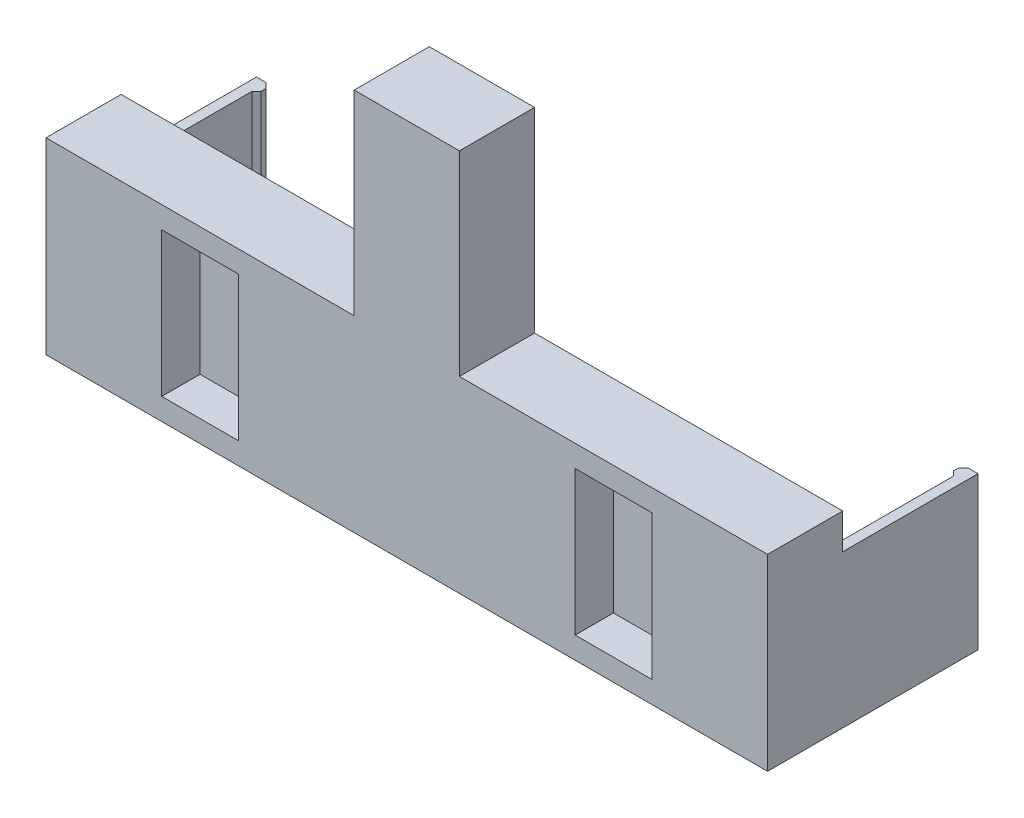
from build123d import *

# Parameters (mm, degrees)
SKETCH1_W                = 1.5
SKETCH1_H                = 25
SKETCH1_W_2              = 14
SKETCH1_H_2              = 26
SKETCH1_R                = 2
BOSS_EXTRUDE1_DEPTH      = 10
SKETCH1_3_W              = 1.5
SKETCH1_3_H              = 25
BOSS_EXTRUDE2_DEPTH      = 18
SKETCH1_4_R              = 2
BOSS_EXTRUDE3_DEPTH      = 5
BOSS_EXTRUDE4_DEPTH      = 25
CUT_EXTRUDE1_DEPTH       = 4.7
CUT_EXTRUDE2_DEPTH       = 7
SKETCH8_W                = 10
SKETCH8_H                = 19
CUT_EXTRUDE3_DEPTH       = 5
MOVE_START               = -12.5
MOVE_FACE1_DEPTH         = 20.3
MOVE_START_2             = -5
MOVE_FACE1_2_OUTLINE_R   = 2
MOVE_FACE1_2_OUTLINE_R_2 = 1.85
MOVE_FACE1_2_DEPTH       = 5
MOVE_FACE1_3_OUTLINE_R   = 1.85
MOVE_FACE1_3_DEPTH       = 0.15
MOVE_FACE2_BY            = 0.1
MOVE_FACE2_2_BY          = 0.1
MOVE_FACE2_3_BY          = 0.1
MOVE_FACE2_4_BY          = 0.1
MOVE_FACE2_5_BY          = 0.1
MOVE_FACE2_6_BY          = 0.1
MOVE_FACE2_7_BY          = 0.1
MOVE_FACE2_8_BY          = 0.1
MOVE_FACE2_9_BY          = 0.1
MOVE_FACE2_10_BY         = 0.1


# Read off the part's stored shape, not the designer's step: Move Face1
with BuildPart() as part:
    # Sketch1 → Boss-Extrude1 (new body)
    # profile 1 of 5: a face of its own
    with BuildSketch(Plane.XY):
        Polygon((-7, 12.5), (-46.5, 12.5), (-46.5, -12.5), (46.5, -12.5), (46.5, 12.5), (7, 12.5), align=None)
    # profile 2 of 5: a face of its own
    with BuildSketch(Plane.XY):
        with Locations((-47.25, 0)):
            Rectangle(SKETCH1_W, SKETCH1_H)
    # profile 3 of 5: a face of its own
    with BuildSketch(Plane.XY):
        with Locations((47.25, 0)):
            Rectangle(SKETCH1_W, SKETCH1_H)
    # profile 4 of 5: a face of its own
    with BuildSketch(Plane.XY):
        with Locations((0, 25.5)):
            Rectangle(SKETCH1_W_2, SKETCH1_H_2)
        with Locations((0, 31.5)):
            Circle(SKETCH1_R, mode=Mode.SUBTRACT)
    # profile 5 of 5: a face of its own
    with BuildSketch(Plane.XY):
        with Locations((0, 31.5)):
            Circle(SKETCH1_R)
    extrude(amount=BOSS_EXTRUDE1_DEPTH)

    # Sketch1<3> → Boss-Extrude2 (add)
    with BuildSketch(Plane.XY):
        with Locations((47.25, 0)):
            Rectangle(SKETCH1_3_W, SKETCH1_3_H)
        with Locations((-47.25, 0)):
            Rectangle(SKETCH1_3_W, SKETCH1_3_H)
    extrude(amount=-BOSS_EXTRUDE2_DEPTH)

    # Sketch1<4> → Boss-Extrude3 (add)
    with BuildSketch(Plane.XY):
        with Locations((0, 31.5)):
            Circle(SKETCH1_4_R)
    extrude(amount=-BOSS_EXTRUDE3_DEPTH)

    # Sketch5 → Boss-Extrude4 (add)
    with BuildSketch(Plane(origin=(0, 12.5, 0), x_dir=(1, 0, 0), z_dir=(0, 1, 0))):
        Polygon((45.9, 17.4), (45.9, 16.6), (46.5, 16), (46.5, 18), align=None)
        Polygon((-45.9, 17.4), (-46.5, 18), (-46.5, 16), (-45.9, 16.6), align=None)
    extrude(amount=-BOSS_EXTRUDE4_DEPTH)

    # Sketch7 → Cut-Extrude1 (cut)
    with BuildSketch(Plane(origin=(0, 12.5, 0), x_dir=(1, 0, 0), z_dir=(0, 1, 0))):
        Polygon((46.5, 16), (46.5, 0), (48, 0), (48, 18), (46.5, 18), (45.9, 17.4), (45.9, 16.6), align=None)
    extrude(amount=-CUT_EXTRUDE1_DEPTH, mode=Mode.SUBTRACT)

    # Sketch7<4> → Cut-Extrude2 (cut)
    with BuildSketch(Plane(origin=(0, 12.5, 0), x_dir=(1, 0, 0), z_dir=(0, 1, 0))):
        Polygon((-48, 0), (-46.5, 0), (-46.5, 16), (-45.9, 16.6), (-45.9, 17.4), (-46.5, 18), (-48, 18), align=None)
    extrude(amount=-CUT_EXTRUDE2_DEPTH, mode=Mode.SUBTRACT)

    # Sketch8 → Cut-Extrude3 (cut)
    with BuildSketch(Plane.XY.offset(10)):
        with Locations((-27.5, 0)):
            Rectangle(SKETCH8_W, SKETCH8_H)
        with Locations((27.5, 0)):
            Rectangle(SKETCH8_W, SKETCH8_H)
    extrude(amount=-CUT_EXTRUDE3_DEPTH, mode=Mode.SUBTRACT)

    # Move Face1 outline → Move Face1 (cut)
    with BuildSketch(Plane(origin=(0, 0, 0), x_dir=(1, 0, 0), z_dir=(0, 1, 0)).offset(MOVE_START)):
        Polygon((-46.05, 16.662132034), (-46.65, 16.062132034), (-46.65, 0), (-46.5, 0), (-46.5, 16), (-45.9, 16.6), (-45.9, 17.4), (-46.5, 18), (-46.712132034, 18), (-46.05, 17.337867966), align=None)
        Polygon((46.5, 16), (46.5, 0), (46.65, 0), (46.65, 16.062132034), (46.05, 16.662132034), (46.05, 17.337867966), (46.712132034, 18), (46.5, 18), (45.9, 17.4), (45.9, 16.6), align=None)
    extrude(amount=MOVE_FACE1_DEPTH, mode=Mode.SUBTRACT)

    # Move Face1 2 outline → Move Face1 2 (cut)
    with BuildSketch(Plane.XY.offset(MOVE_START_2)):
        with Locations((0, 31.5)):
            Circle(MOVE_FACE1_2_OUTLINE_R)
        with Locations((0, 31.5)):
            Circle(MOVE_FACE1_2_OUTLINE_R_2, mode=Mode.SUBTRACT)
    extrude(amount=MOVE_FACE1_2_DEPTH, mode=Mode.SUBTRACT)

    # Move Face1 3 outline → Move Face1 3 (cut)
    with BuildSketch(Plane.XY.offset(MOVE_START_2)):
        with Locations((0, 31.5)):
            Circle(MOVE_FACE1_3_OUTLINE_R)
    extrude(amount=MOVE_FACE1_3_DEPTH, mode=Mode.SUBTRACT)

    # Move Face2: a face moved inward by 0.1
    extrude(part.faces().sort_by_distance((-22.5, 0, 7.5))[0], amount=MOVE_FACE2_BY, dir=(1, 0, 0), mode=Mode.SUBTRACT)

    # Move Face2 2: a face moved inward by 0.1
    extrude(part.faces().sort_by_distance((-32.5, 0, 7.5))[0], amount=MOVE_FACE2_2_BY, dir=(-1, 0, 0), mode=Mode.SUBTRACT)

    # Move Face2 3: a face moved inward by 0.1
    extrude(part.faces().sort_by_distance((27.5, -9.5, 7.5))[0], amount=MOVE_FACE2_3_BY, dir=(0, -1, 0), mode=Mode.SUBTRACT)

    # Move Face2 4: a face moved inward by 0.1
    extrude(part.faces().sort_by_distance((22.5, 0, 7.5))[0], amount=MOVE_FACE2_4_BY, dir=(-1, 0, 0), mode=Mode.SUBTRACT)

    # Move Face2 5: a face moved inward by 0.1
    extrude(part.faces().sort_by_distance((32.5, 0, 7.5))[0], amount=MOVE_FACE2_5_BY, dir=(1, 0, 0), mode=Mode.SUBTRACT)

    # Move Face2 6: a face moved inward by 0.1
    extrude(part.faces().sort_by_distance((27.5, 9.5, 7.5))[0], amount=MOVE_FACE2_6_BY, dir=(0, 1, 0), mode=Mode.SUBTRACT)

    # Move Face2 7: a face moved inward by 0.1
    extrude(part.faces().sort_by_distance((27.5, 0, 5))[0], amount=MOVE_FACE2_7_BY, dir=(0, 0, -1), mode=Mode.SUBTRACT)

    # Move Face2 8: a face moved inward by 0.1
    extrude(part.faces().sort_by_distance((-27.5, -9.5, 7.5))[0], amount=MOVE_FACE2_8_BY, dir=(0, -1, 0), mode=Mode.SUBTRACT)

    # Move Face2 9: a face moved inward by 0.1
    extrude(part.faces().sort_by_distance((-27.5, 9.5, 7.5))[0], amount=MOVE_FACE2_9_BY, dir=(0, 1, 0), mode=Mode.SUBTRACT)

    # Move Face2 10: a face moved inward by 0.1
    extrude(part.faces().sort_by_distance((-27.5, 0, 5))[0], amount=MOVE_FACE2_10_BY, dir=(0, 0, -1), mode=Mode.SUBTRACT)


solid = part.part
